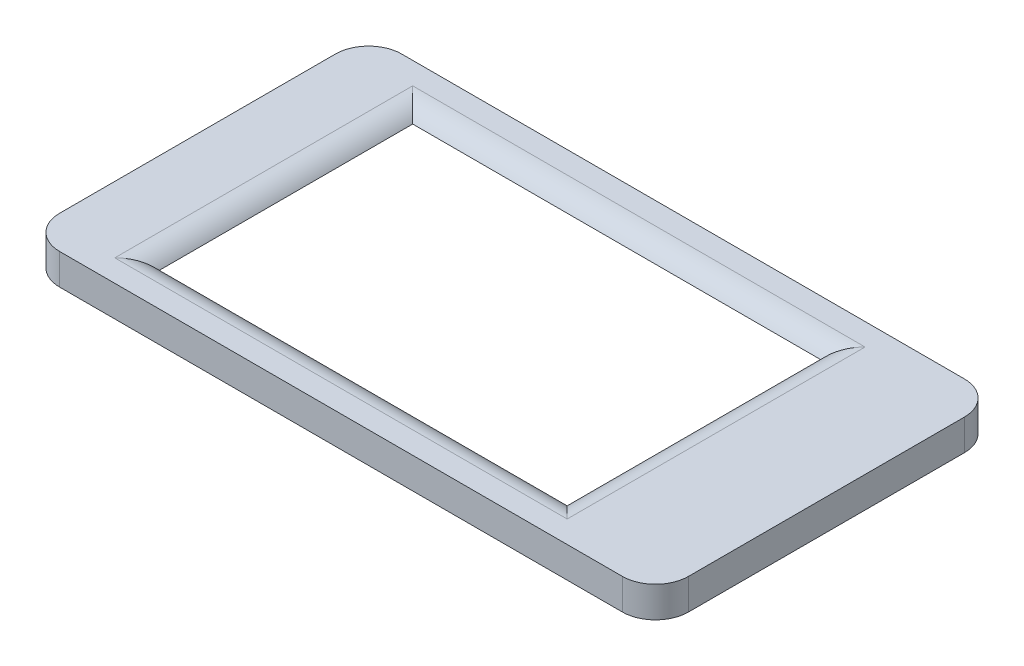
from build123d import *

# Parameters (mm, degrees)
SKETCH_1_W            = 114
SKETCH_1_H            = 62
EXTRUDE_1_DEPTH       = 5.6
SKETCH_5_R            = 3
CUT_EXTRUDE_865_DEPTH = 3
SKETCH_7_W            = 85
SKETCH_7_H            = 58
LCD_DEPTH             = 3.6
SKETCH_13_W           = 74
SKETCH_13_H           = 46
CUT_EXTRUDE_1_DEPTH   = 10
FILLET_2_R            = 5
FILLET_3_R            = 6


with BuildPart() as part:
    # Эскиз1 → Бобышка-Вытянуть1 (new body)
    with BuildSketch(Plane(origin=(0, 0, 0), x_dir=(1, 0, 0), z_dir=(0, 1, 0))):
        with Locations((-2, 0)):
            Rectangle(SKETCH_1_W, SKETCH_1_H)
    extrude(amount=EXTRUDE_1_DEPTH)

    # Эскиз5 → Cut-Extrude 865 (cut)
    with BuildSketch(Plane.XZ):
        with Locations(Location((-54, 21, 0), (0, 0, 270))):
            Circle(SKETCH_5_R)
        with Locations(Location((-54, -21, 0), (0, 0, 90))):
            Circle(SKETCH_5_R)
        with Locations(Location((39, 21, 0), (0, 0, 270))):
            Circle(SKETCH_5_R)
        with Locations(Location((39, -21, 0), (0, 0, 90))):
            Circle(SKETCH_5_R)
    extrude(amount=-CUT_EXTRUDE_865_DEPTH, mode=Mode.SUBTRACT)

    # Эскиз7 → под LCD (cut)
    with BuildSketch(Plane.XZ):
        with Locations((-7.5, 0)):
            Rectangle(SKETCH_7_W, SKETCH_7_H)
    extrude(amount=-LCD_DEPTH, mode=Mode.SUBTRACT)

    # Эскиз13 → Вырез-Вытянуть1 (cut)
    with BuildSketch(Plane.XZ.offset(-3.6)):
        with Locations((-6, 0)):
            Rectangle(SKETCH_13_W, SKETCH_13_H)
    extrude(amount=-CUT_EXTRUDE_1_DEPTH, mode=Mode.SUBTRACT)

    # Скругление2
    # the kernel refuses this fillet: 5 mm, written as the material it takes off along each edge
    with BuildSketch(Plane(origin=(-43, 5.6, 23), x_dir=(-1, 0, 0), z_dir=(0, 0, -1)), Plane(origin=(31, 5.6, -23), x_dir=(1, 0, 0), z_dir=(0, 0, 1))) as fillet_2_piece_1:
        with BuildLine():
            CenterArc((4, -5), FILLET_2_R, 90, 53.130102354)
            Line((0, -2), (-0.08, -1.94))
            ThreePointArc((-0.08, -1.94), (-0.1, -1), (-0.1, 0))
            Line((-0.1, 0), (0, 0.1))
            Line((0, 0.1), (4, 0.1))
            Line((4, 0.1), (4, 0))
        make_face()
    extrude(amount=46, mode=Mode.SUBTRACT)
    with BuildSketch(Plane(origin=(31, 5.6, 23), x_dir=(0, 0, 1), z_dir=(-1, 0, 0)), Plane(origin=(-43, 5.6, -23), x_dir=(0, 0, -1), z_dir=(1, 0, 0))) as fillet_2_piece_2:
        with BuildLine():
            CenterArc((4, -5), FILLET_2_R, 90, 53.130102354)
            Line((0, -2), (-0.08, -1.94))
            ThreePointArc((-0.08, -1.94), (-0.1, -1), (-0.1, 0))
            Line((-0.1, 0), (0, 0.1))
            Line((0, 0.1), (4, 0.1))
            Line((4, 0.1), (4, 0))
        make_face()
    extrude(amount=74, mode=Mode.SUBTRACT)
    with BuildSketch(Plane(origin=(31, 5.6, 23), x_dir=(0, 0, 1), z_dir=(-1, 0, 0))) as fillet_2_piece_3a_section:
        with BuildLine():
            CenterArc((4, -5), FILLET_2_R, 90, 53.130102354)
            Line((0, -2), (-0.08, -1.94))
            ThreePointArc((-0.08, -1.94), (-0.1, -1), (-0.1, 0))
            Line((-0.1, 0), (0, 0.1))
            Line((0, 0.1), (4, 0.1))
            Line((4, 0.1), (4, 0))
        make_face()
    fillet_2_piece_3a = extrude(amount=84, mode=Mode.PRIVATE)
    fillet_2_piece_3a = split(fillet_2_piece_3a, bisect_by=Plane(origin=(-43, 5.088057438, 24.029417057), z_dir=(-1, 0, 0)), keep=Keep.TOP, mode=Mode.PRIVATE)
    with BuildSketch(Plane(origin=(-43, 5.6, 33), x_dir=(-1, 0, 0), z_dir=(0, 0, -1))) as fillet_2_piece_3b_section:
        with BuildLine():
            CenterArc((4, -5), FILLET_2_R, 90, 53.130102354)
            Line((0, -2), (-0.08, -1.94))
            ThreePointArc((-0.08, -1.94), (-0.1, -1), (-0.1, 0))
            Line((-0.1, 0), (0, 0.1))
            Line((0, 0.1), (4, 0.1))
            Line((4, 0.1), (4, 0))
        make_face()
    fillet_2_piece_3b = extrude(amount=56, mode=Mode.PRIVATE)
    fillet_2_piece_3b = split(fillet_2_piece_3b, bisect_by=Plane(origin=(-44.029417057, 5.088057438, 23), z_dir=(0, 0, 1)), keep=Keep.TOP, mode=Mode.PRIVATE)
    fillet_2_piece_3 = fillet_2_piece_3a & fillet_2_piece_3b
    add(fillet_2_piece_3, mode=Mode.SUBTRACT)
    with BuildSketch(Plane(origin=(-43, 5.6, 23), x_dir=(-1, 0, 0), z_dir=(0, 0, -1))) as fillet_2_piece_4a_section:
        with BuildLine():
            CenterArc((4, -5), FILLET_2_R, 90, 53.130102354)
            Line((0, -2), (-0.08, -1.94))
            ThreePointArc((-0.08, -1.94), (-0.1, -1), (-0.1, 0))
            Line((-0.1, 0), (0, 0.1))
            Line((0, 0.1), (4, 0.1))
            Line((4, 0.1), (4, 0))
        make_face()
    fillet_2_piece_4a = extrude(amount=56, mode=Mode.PRIVATE)
    fillet_2_piece_4a = split(fillet_2_piece_4a, bisect_by=Plane(origin=(-44.029417057, 5.088057438, -23), z_dir=(0, 0, -1)), keep=Keep.TOP, mode=Mode.PRIVATE)
    with BuildSketch(Plane(origin=(-53, 5.6, -23), x_dir=(0, 0, -1), z_dir=(1, 0, 0))) as fillet_2_piece_4b_section:
        with BuildLine():
            CenterArc((4, -5), FILLET_2_R, 90, 53.130102354)
            Line((0, -2), (-0.08, -1.94))
            ThreePointArc((-0.08, -1.94), (-0.1, -1), (-0.1, 0))
            Line((-0.1, 0), (0, 0.1))
            Line((0, 0.1), (4, 0.1))
            Line((4, 0.1), (4, 0))
        make_face()
    fillet_2_piece_4b = extrude(amount=84, mode=Mode.PRIVATE)
    fillet_2_piece_4b = split(fillet_2_piece_4b, bisect_by=Plane(origin=(-43, 5.088057438, -24.029417057), z_dir=(-1, 0, 0)), keep=Keep.TOP, mode=Mode.PRIVATE)
    fillet_2_piece_4 = fillet_2_piece_4a & fillet_2_piece_4b
    add(fillet_2_piece_4, mode=Mode.SUBTRACT)
    with BuildSketch(Plane(origin=(41, 5.6, 23), x_dir=(0, 0, 1), z_dir=(-1, 0, 0))) as fillet_2_piece_5a_section:
        with BuildLine():
            CenterArc((4, -5), FILLET_2_R, 90, 53.130102354)
            Line((0, -2), (-0.08, -1.94))
            ThreePointArc((-0.08, -1.94), (-0.1, -1), (-0.1, 0))
            Line((-0.1, 0), (0, 0.1))
            Line((0, 0.1), (4, 0.1))
            Line((4, 0.1), (4, 0))
        make_face()
    fillet_2_piece_5a = extrude(amount=84, mode=Mode.PRIVATE)
    fillet_2_piece_5a = split(fillet_2_piece_5a, bisect_by=Plane(origin=(31, 5.088057438, 24.029417057), z_dir=(1, 0, 0)), keep=Keep.TOP, mode=Mode.PRIVATE)
    with BuildSketch(Plane(origin=(31, 5.6, -23), x_dir=(1, 0, 0), z_dir=(0, 0, 1))) as fillet_2_piece_5b_section:
        with BuildLine():
            CenterArc((4, -5), FILLET_2_R, 90, 53.130102354)
            Line((0, -2), (-0.08, -1.94))
            ThreePointArc((-0.08, -1.94), (-0.1, -1), (-0.1, 0))
            Line((-0.1, 0), (0, 0.1))
            Line((0, 0.1), (4, 0.1))
            Line((4, 0.1), (4, 0))
        make_face()
    fillet_2_piece_5b = extrude(amount=56, mode=Mode.PRIVATE)
    fillet_2_piece_5b = split(fillet_2_piece_5b, bisect_by=Plane(origin=(32.029417057, 5.088057438, 23), z_dir=(0, 0, 1)), keep=Keep.TOP, mode=Mode.PRIVATE)
    fillet_2_piece_5 = fillet_2_piece_5a & fillet_2_piece_5b
    add(fillet_2_piece_5, mode=Mode.SUBTRACT)
    with BuildSketch(Plane(origin=(-43, 5.6, -23), x_dir=(0, 0, -1), z_dir=(1, 0, 0))) as fillet_2_piece_6a_section:
        with BuildLine():
            CenterArc((4, -5), FILLET_2_R, 90, 53.130102354)
            Line((0, -2), (-0.08, -1.94))
            ThreePointArc((-0.08, -1.94), (-0.1, -1), (-0.1, 0))
            Line((-0.1, 0), (0, 0.1))
            Line((0, 0.1), (4, 0.1))
            Line((4, 0.1), (4, 0))
        make_face()
    fillet_2_piece_6a = extrude(amount=84, mode=Mode.PRIVATE)
    fillet_2_piece_6a = split(fillet_2_piece_6a, bisect_by=Plane(origin=(31, 5.088057438, -24.029417057), z_dir=(1, 0, 0)), keep=Keep.TOP, mode=Mode.PRIVATE)
    with BuildSketch(Plane(origin=(31, 5.6, -33), x_dir=(1, 0, 0), z_dir=(0, 0, 1))) as fillet_2_piece_6b_section:
        with BuildLine():
            CenterArc((4, -5), FILLET_2_R, 90, 53.130102354)
            Line((0, -2), (-0.08, -1.94))
            ThreePointArc((-0.08, -1.94), (-0.1, -1), (-0.1, 0))
            Line((-0.1, 0), (0, 0.1))
            Line((0, 0.1), (4, 0.1))
            Line((4, 0.1), (4, 0))
        make_face()
    fillet_2_piece_6b = extrude(amount=56, mode=Mode.PRIVATE)
    fillet_2_piece_6b = split(fillet_2_piece_6b, bisect_by=Plane(origin=(32.029417057, 5.088057438, -23), z_dir=(0, 0, -1)), keep=Keep.TOP, mode=Mode.PRIVATE)
    fillet_2_piece_6 = fillet_2_piece_6a & fillet_2_piece_6b
    add(fillet_2_piece_6, mode=Mode.SUBTRACT)

    # Скругление3
    fillet_3_edges = [part.edges().sort_by_distance(p)[0] for p in [
        (55, 2.8, 31),
        (-59, 2.8, 31),
        (-59, 2.8, -31),
        (55, 2.8, -31),
    ]]
    fillet(fillet_3_edges, radius=FILLET_3_R)


solid = part.part
